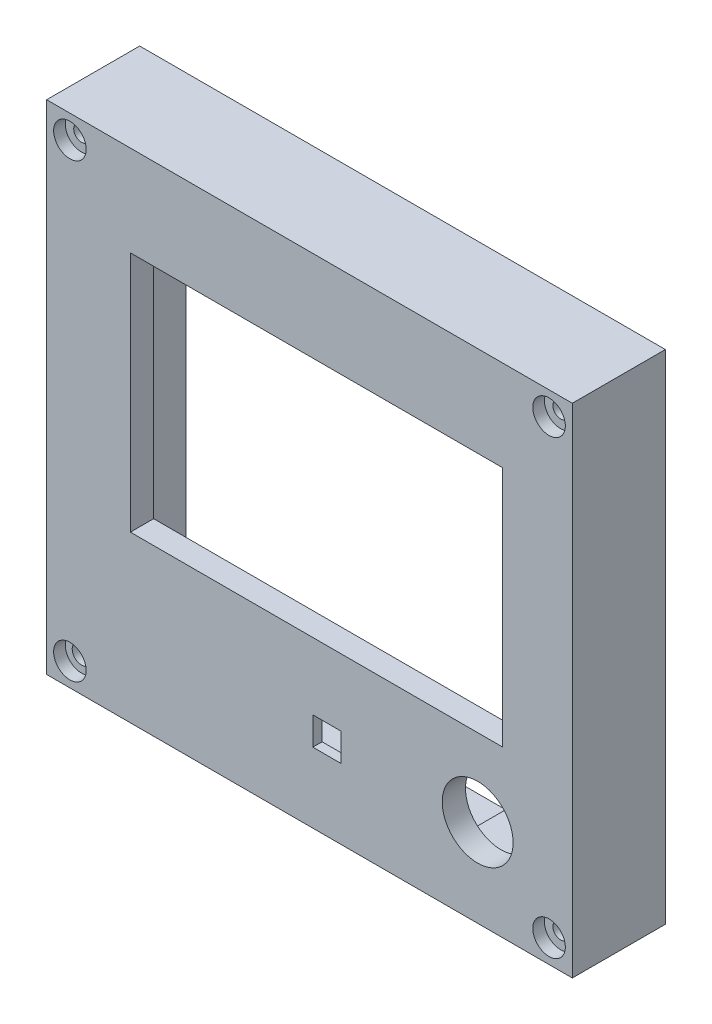
from build123d import *
from build123d.topology import SkipClean

# Parameters (mm, degrees)
SKETCH1_W           = 113
SKETCH1_H           = 107
BOSS_EXTRUDE1_DEPTH = 5
SKETCH6_R           = 3.5
CUT_EXTRUDE3_DEPTH  = 2.5
SKETCH7_R           = 7.62
SKETCH7_W           = 80
SKETCH7_H           = 52
SKETCH7_W_2         = 6.0198
SKETCH7_H_2         = 6.0198
CUT_EXTRUDE4_DEPTH  = 78.97114851
SKETCH9_W           = 10.0198
SKETCH9_H           = 10.0198
CUT_EXTRUDE5_DEPTH  = 2
SKETCH10_R          = 1.68009103
SKETCH10_R_2        = 2
CUT_EXTRUDE6_DEPTH  = 78.850818878
SKETCH11_W          = 68.416378349
SKETCH11_H          = 30.356890758
CUT_EXTRUDE10_DEPTH = 3
SKETCH12_R          = 1.68009103
SKETCH12_R_2        = 2
BOSS_EXTRUDE2_DEPTH = 15


with BuildPart() as part:
    # Sketch1 → Boss-Extrude1 (new body)
    with BuildSketch(Plane.XY):
        Rectangle(SKETCH1_W, SKETCH1_H)
    extrude(amount=BOSS_EXTRUDE1_DEPTH)

    # Sketch6 → Cut-Extrude3 (cut)
    with BuildSketch(Plane.XY.offset(5)):
        with Locations((-51.5, 48.5)):
            Circle(SKETCH6_R)
        with Locations((-51.5, -48.5)):
            Circle(SKETCH6_R)
        with Locations((51.5, -48.5)):
            Circle(SKETCH6_R)
        with Locations((51.5, 48.5)):
            Circle(SKETCH6_R)
    extrude(amount=-CUT_EXTRUDE3_DEPTH, mode=Mode.SUBTRACT)

    # Sketch7 → Cut-Extrude4 (cut, through all)
    with BuildSketch(Plane.XY.offset(5)):
        with Locations((36.1495, -34.6735)):
            Circle(SKETCH7_R)
        with Locations((1.5, 8)):
            Rectangle(SKETCH7_W, SKETCH7_H)
        with Locations((3.7199, -35.4101)):
            Rectangle(SKETCH7_W_2, SKETCH7_H_2)
    extrude(amount=-CUT_EXTRUDE4_DEPTH, mode=Mode.SUBTRACT)

    # Sketch9 → Cut-Extrude5 (cut)
    with BuildSketch(Plane(origin=(0, 0, 0), x_dir=(-1, 0, 0), z_dir=(0, 0, -1))):
        with Locations((-3.7199, -35.4101)):
            Rectangle(SKETCH9_W, SKETCH9_H)
    extrude(amount=-CUT_EXTRUDE5_DEPTH, mode=Mode.SUBTRACT)

    # Sketch10 → Cut-Extrude6 (cut, through all)
    with BuildSketch(Plane.XY.offset(2.5)):
        with Locations((-51.5, 48.5)):
            Circle(SKETCH10_R)
        with Locations((51.5, 48.5)):
            Circle(SKETCH10_R)
        with Locations((51.5, -48.5)):
            Circle(SKETCH10_R)
        with Locations((-51.5, -48.5)):
            Circle(SKETCH10_R_2)
    extrude(amount=-CUT_EXTRUDE6_DEPTH, mode=Mode.SUBTRACT)

    # Sketch11 → Cut-Extrude10 (cut)
    with BuildSketch(Plane(origin=(0, 0, 0), x_dir=(-1, 0, 0), z_dir=(0, 0, -1))):
        with Locations((6.194052886, -34.147771582)):
            Rectangle(SKETCH11_W, SKETCH11_H)
    extrude(amount=-CUT_EXTRUDE10_DEPTH, mode=Mode.SUBTRACT)

    # Sketch12 → Boss-Extrude2 (add)
    with SkipClean():  # the faces are left unmerged after this step: merging them gives an invalid solid
        with BuildSketch(Plane(origin=(0, 0, 0), x_dir=(-1, 0, 0), z_dir=(0, 0, -1))):
            Polygon((56.5, 43.5), (56.5, 53.5), (46.5, 53.5), (-46.5, 53.5), (-56.5, 53.5), (-56.5, 43.5), (-56.5, -43.5), (-56.5, -53.5), (-46.5, -53.5), (46.5, -53.5), (56.5, -53.5), (56.5, -43.5), align=None)
            with Locations((-51.5, -48.5)):
                Circle(SKETCH12_R, mode=Mode.SUBTRACT)
            with Locations((51.5, -48.5)):
                Circle(SKETCH12_R_2, mode=Mode.SUBTRACT)
            Polygon((-46.5, 43.5), (46.5, 43.5), (46.5, -43.5), (40.402242061, -43.5), (40.402242061, -49.326216961), (-28.014136288, -49.326216961), (-28.014136288, -43.5), (-46.5, -43.5), align=None, mode=Mode.SUBTRACT)
            with Locations((-51.5, 48.5)):
                Circle(SKETCH12_R, mode=Mode.SUBTRACT)
            with Locations((51.5, 48.5)):
                Circle(SKETCH12_R, mode=Mode.SUBTRACT)
        extrude(amount=BOSS_EXTRUDE2_DEPTH)


solid = part.part
